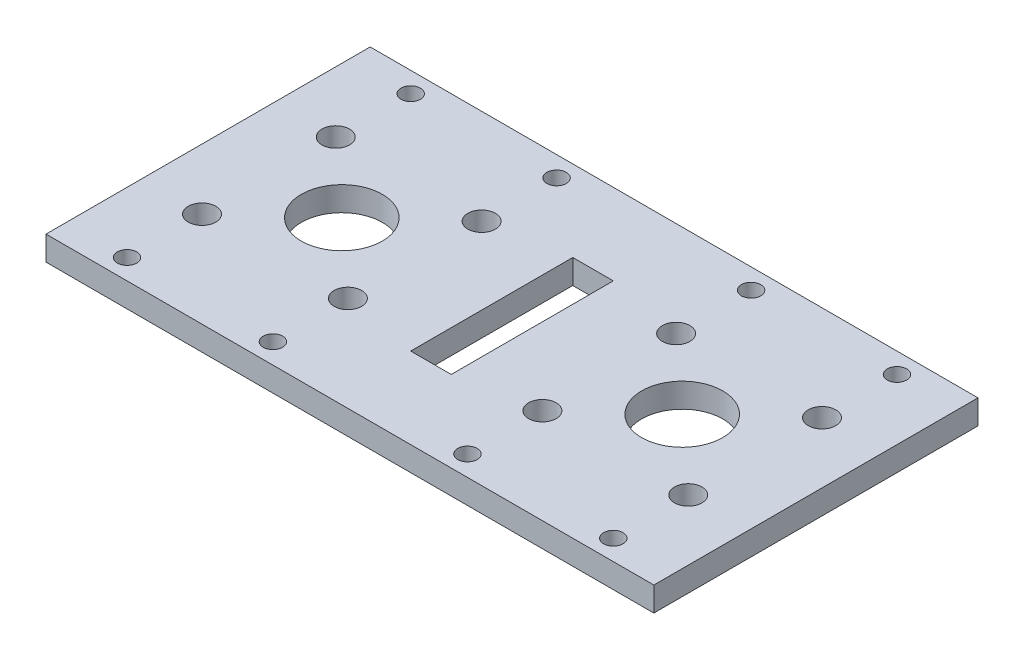
from build123d import *

# Parameters (mm, degrees)
SKETCH1_W           = 75
SKETCH1_H           = 40
SKETCH1_R           = 5
SKETCH1_R_2         = 1.7
SKETCH1_R_3         = 1.197563381
SKETCH1_W_2         = 5
SKETCH1_H_2         = 20
BOSS_EXTRUDE1_DEPTH = 3


with BuildPart() as part:
    # Sketch1 → Boss-Extrude1 (new body)
    with BuildSketch(Plane(origin=(0, 0, 0), x_dir=(1, 0, 0), z_dir=(0, 1, 0))):
        Rectangle(SKETCH1_W, SKETCH1_H)
        with Locations((-21, 0)):
            Circle(SKETCH1_R, mode=Mode.SUBTRACT)
        with Locations((-30, 8.25)):
            Circle(SKETCH1_R_2, mode=Mode.SUBTRACT)
        with Locations((-12, 8.25)):
            Circle(SKETCH1_R_2, mode=Mode.SUBTRACT)
        with Locations((-12, -8.25)):
            Circle(SKETCH1_R_2, mode=Mode.SUBTRACT)
        with Locations((-30, -8.25)):
            Circle(SKETCH1_R_2, mode=Mode.SUBTRACT)
        with Locations((12, 8.25)):
            Circle(SKETCH1_R_2, mode=Mode.SUBTRACT)
        with Locations((12, -8.25)):
            Circle(SKETCH1_R_2, mode=Mode.SUBTRACT)
        with Locations((21, 0)):
            Circle(SKETCH1_R, mode=Mode.SUBTRACT)
        with Locations((30, -8.25)):
            Circle(SKETCH1_R_2, mode=Mode.SUBTRACT)
        with Locations((30, 8.25)):
            Circle(SKETCH1_R_2, mode=Mode.SUBTRACT)
        with Locations((-30, -17.5)):
            Circle(SKETCH1_R_3, mode=Mode.SUBTRACT)
        with Locations((-12, -17.5)):
            Circle(SKETCH1_R_3, mode=Mode.SUBTRACT)
        with Locations((12, -17.5)):
            Circle(SKETCH1_R_3, mode=Mode.SUBTRACT)
        with Locations((30, -17.5)):
            Circle(SKETCH1_R_3, mode=Mode.SUBTRACT)
        with Locations((30, 17.5)):
            Circle(SKETCH1_R_3, mode=Mode.SUBTRACT)
        with Locations((12, 17.5)):
            Circle(SKETCH1_R_3, mode=Mode.SUBTRACT)
        with Locations((-12, 17.5)):
            Circle(SKETCH1_R_3, mode=Mode.SUBTRACT)
        with Locations((-30, 17.5)):
            Circle(SKETCH1_R_3, mode=Mode.SUBTRACT)
        Rectangle(SKETCH1_W_2, SKETCH1_H_2, mode=Mode.SUBTRACT)
    extrude(amount=BOSS_EXTRUDE1_DEPTH)


solid = part.part
